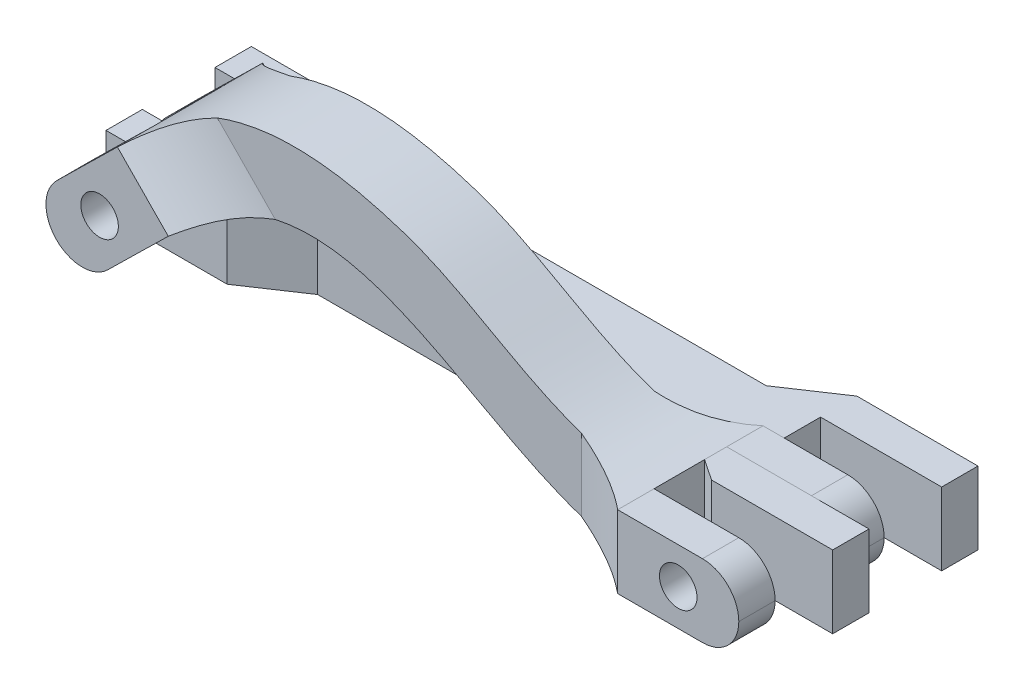
from build123d import *

# Parameters (mm, degrees)
BOSS_EXTRUDE1_DEPTH     = 6
BOSS_EXTRUDE3_DEPTH     = 12
CUT_EXTRUDE4_DEPTH      = 37.049995733
CUT_EXTRUDE4_DEPTH_BACK = 37.049995733
SKETCH7_OUTSIDE_W       = 75.148
SKETCH7_OUTSIDE_H       = 32.948
CUT_EXTRUDE5_DEPTH      = 52.439728324
CUT_EXTRUDE5_DEPTH_BACK = 52.439728324
SKETCH8_OUTSIDE_W       = 68.864
SKETCH8_OUTSIDE_H       = 32.948
CUT_EXTRUDE6_DEPTH      = 52.439728324
CUT_EXTRUDE6_DEPTH_BACK = 52.439728324
SKETCH9_W               = 10
SKETCH9_H               = 6
CUT_EXTRUDE7_DEPTH      = 37.049995651
CUT_EXTRUDE7_DEPTH_BACK = 37.049995651
SKETCH11_W              = 10
SKETCH11_H              = 6
FILLET6_R               = 3
CUT_EXTRUDE8_DEPTH      = 36.882616772
CUT_EXTRUDE8_DEPTH_BACK = 36.882616772
SKETCH12_R              = 1.55


with BuildPart() as part:
    # Sketch1 → Boss-Extrude1 (new body)
    with BuildSketch(Plane(origin=(0, 0, 0), x_dir=(1, 0, 0), z_dir=(0, 1, 0))):
        Polygon((-15.518119067, -3), (15.518119067, -3), (20, -6), (30, -6), (30, -3), (20, -3), (20, 3), (30, 3), (30, 6), (20, 6), (15.518119067, 3), (-15.518119067, 3), (-20, 6), (-30, 6), (-30, 3), (-20, 3), (-20, -3), (-30, -3), (-30, -6), (-20, -6), align=None)
    extrude(amount=BOSS_EXTRUDE1_DEPTH)


with BuildPart() as body_2:
    # Sketch6 → Boss-Extrude3 (new body)
    with BuildSketch(Plane.XY):
        with BuildLine():
            Line((-26, 0), (-30.2, 4.284857057))
            Line((-30.2, 4.284857057), (-23.058571571, 11.284857057))
            add(Edge.make_bspline(
                [(-23.058571571, 11.284857057), (-16.280617583, 17.297584134), (-6.430302784, 15.40158151), (4.621913896, 11.523854346), (10.559700869, 5.982548446), (18.25, 6)],
                knots=[0, 0, 0, 0, 0.365108975, 0.440504909, 1, 1, 1, 1], degree=3))
            Line((18.25, 6), (28.25, 6))
            Line((28.25, 6), (28.25, 0))
            Line((28.25, 0), (18.25, 0))
            add(Edge.make_bspline(
                [(18.25, 0), (5.045706923, -0.060114648), (-4.929344709, 16.502964239), (-18.858571571, 7)],
                knots=[0, 0, 0, 0, 1, 1, 1, 1], degree=3))
            Line((-18.858571571, 7), (-26, 0))
        make_face()
    extrude(amount=BOSS_EXTRUDE3_DEPTH)

    # Sketch7 outside → Cut-Extrude4 (cut, two sides: drawn at the far end of the back side and taken through both)
    with BuildSketch(Plane(origin=(0, 0, 0), x_dir=(1, 0, 0), z_dir=(0, 1, 0)).offset(-CUT_EXTRUDE4_DEPTH_BACK)):
        with Locations((-0.1, -3)):
            Rectangle(SKETCH7_OUTSIDE_W, SKETCH7_OUTSIDE_H)
        with BuildLine():
            Line((12.25, -3), (-6.75, -3))
            Line((-6.75, -3), (-6.75, 2.721292481))
            Line((-6.75, 2.721292481), (-31.75, 2.721292481))
            Line((-31.75, 2.721292481), (-31.75, -14.721292481))
            Line((-31.75, -14.721292481), (-6.75, -14.721292481))
            Line((-6.75, -14.721292481), (-6.75, -9))
            Line((-6.75, -9), (12.25, -9))
            ThreePointArc((12.25, -9), (15.419855517, -10.160288966), (18.25, -12))
            Line((18.25, -12), (28.25, -12))
            Line((28.25, -12), (28.25, 0))
            Line((28.25, 0), (18.25, 0))
            ThreePointArc((18.25, 0), (15.419855517, -1.839711034), (12.25, -3))
        make_face(mode=Mode.SUBTRACT)
    extrude(amount=CUT_EXTRUDE4_DEPTH + CUT_EXTRUDE4_DEPTH_BACK, mode=Mode.SUBTRACT)

    # Sketch8 outside → Cut-Extrude5 (cut, two sides: drawn at the far end of the back side and taken through both)
    with BuildSketch(Plane(origin=(-16.94, 17.282256797, 0), x_dir=(0.7141428428542848, 0.7000000000000003, 0), z_dir=(-0.7000000000000003, 0.7141428428542848, 0)).offset(-CUT_EXTRUDE5_DEPTH_BACK)):
        with Locations((5.391, -3)):
            Rectangle(SKETCH8_OUTSIDE_W, SKETCH8_OUTSIDE_H)
        with BuildLine():
            Line((-18.567713914, 0), (-8.567713914, 0))
            ThreePointArc((-8.567713914, 0), (-5.737569431, -1.839711034), (-2.567713914, -3))
            Line((-2.567713914, -3), (8.133577067, -3))
            Line((8.133577067, -3), (8.133577067, 1.667349742))
            Line((8.133577067, 1.667349742), (26.301862324, 1.667349742))
            Line((26.301862324, 1.667349742), (26.301862324, -13.667349742))
            Line((26.301862324, -13.667349742), (8.133577067, -13.667349742))
            Line((8.133577067, -13.667349742), (8.133577067, -9))
            Line((8.133577067, -9), (-2.567713914, -9))
            ThreePointArc((-2.567713914, -9), (-5.737569431, -10.160288966), (-8.567713914, -12))
            Line((-8.567713914, -12), (-18.567713914, -12))
            Line((-18.567713914, -12), (-18.567713914, 0))
        make_face(mode=Mode.SUBTRACT)
    extrude(amount=CUT_EXTRUDE5_DEPTH + CUT_EXTRUDE5_DEPTH_BACK, mode=Mode.SUBTRACT)

    # Sketch9 → Cut-Extrude6 (cut, two sides: drawn at the far end of the back side and taken through both)
    with BuildSketch(Plane(origin=(-16.94, 17.282256797, 0), x_dir=(0.7141428428542848, 0.7000000000000003, 0), z_dir=(-0.7000000000000003, 0.7141428428542848, 0)).offset(-CUT_EXTRUDE6_DEPTH_BACK)):
        with Locations((-13.567713914, -6)):
            Rectangle(SKETCH9_W, SKETCH9_H)
    extrude(amount=CUT_EXTRUDE6_DEPTH + CUT_EXTRUDE6_DEPTH_BACK, mode=Mode.SUBTRACT)

    # Sketch11 → Cut-Extrude7 (cut, two sides: drawn at the far end of the back side and taken through both)
    with BuildSketch(Plane(origin=(0, 0, 0), x_dir=(1, 0, 0), z_dir=(0, 1, 0)).offset(-CUT_EXTRUDE7_DEPTH_BACK)):
        with Locations((23.25, -6)):
            Rectangle(SKETCH11_W, SKETCH11_H)
    extrude(amount=CUT_EXTRUDE7_DEPTH + CUT_EXTRUDE7_DEPTH_BACK, mode=Mode.SUBTRACT)

    # Fillet6
    fillet6_edges = [body_2.edges().sort_by_distance(p)[0] for p in [
        (28.25, 6, 10.5),
        (28.25, 0, 10.5),
        (28.25, 0, 1.5),
        (28.25, 6, 1.5),
        (-26, 0, 10.5),
        (-30.2, 4.284857057, 10.5),
        (-26, 0, 1.5),
        (-30.2, 4.284857057, 1.5),
    ]]
    fillet(fillet6_edges, radius=FILLET6_R - 0.0001)  # a hair under: the kernel refuses the full size

    # Sketch12 → Cut-Extrude8 (cut, two sides: drawn at the far end of the back side and taken through both)
    with BuildSketch(Plane.XY.offset(-CUT_EXTRUDE8_DEPTH_BACK)):
        with Locations((-24.529285786, 5.642428529)):
            Circle(SKETCH12_R)
        with Locations((23.25, 3)):
            Circle(SKETCH12_R)
    extrude(amount=CUT_EXTRUDE8_DEPTH + CUT_EXTRUDE8_DEPTH_BACK, mode=Mode.SUBTRACT)


solid = Compound([part.part, body_2.part])
